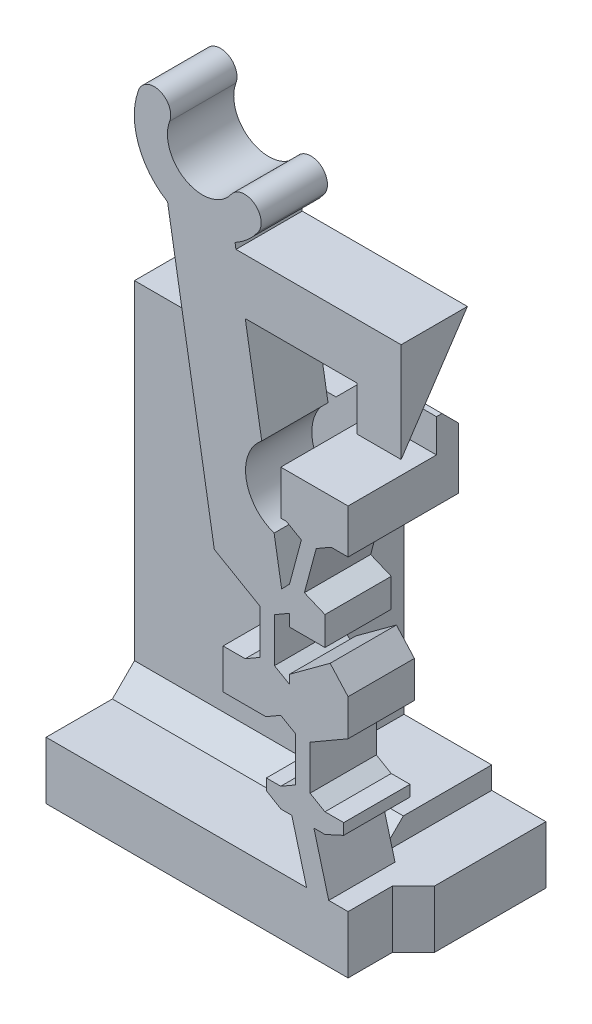
from build123d import *

# Parameters (mm, degrees)
BOSS_SWITCH_BODY_DEPTH                    = 3
SKETCH1_W                                 = 4
SKETCH1_H                                 = 3.5
BOSS_FLANGE_WIDTH_DEPTH                   = 5
BOSS_FLANGE_HEIGHT_REACH                  = 35.863
SKETCH2_W                                 = 4
SKETCH2_H                                 = 2
SKETCH2_W_2                               = 8
SKETCH2_H_2                               = 2.602328973
CUT_UP_TO_DOWN_DERAILLEUR_CLEARANCE_REACH = 21.462
SKETCH10_W                                = 2.453096586
SKETCH10_H                                = 3
SKETCH17_W                                = 12.1675
SKETCH17_H                                = 4
BOSS_FLANGE_SUPPORT_DEPTH                 = 13.897671027
TAP_DRILL_FOR_M2X0_4_TAP1_D               = 1.6
M2_CLEARANCE_HOLE2_D                      = 2.4
M2_CLEARANCE_HOLE2_DEPTH                  = 15
M2_CLEARANCE_HOLE2_TIP                    = 0.721032743
CHAMFER_FLANGE_SUPPORT_SIZE               = 1.5
CHAMFER_FLANGE_SUPPORT_2_SIZE             = 1.5
CHAMFER_FLANGE_SUPPORT_3_SIZE             = 1
SKETCH23_W                                = 3.9675
SKETCH23_H                                = 11.397671027
CUT_GAP_FOR_PRINTING_DEPTH                = 32.000499688
SKETCH25_W                                = 0.953096586
SKETCH25_H                                = 3.5
CUT_DERAILLEUR_CLEARANCE_DEPTH            = 32.145320369
CHAMFER8_SIZE                             = 1
CUT_UP_TO_DOWN_CANTILEVER_SLOPE_REACH     = 31.869
SKETCH26_W                                = 12.477246204
SKETCH26_H                                = 5.771077126
CUT_WIDE_DERAILLEUR_CLEARANCE_DEPTH       = 33.195879702
CUT_WIDE_DERAILLEUR_CLEARANCE_DEPTH_BACK  = 4
SKETCH27_W                                = 2.5
SKETCH27_H                                = 5.000000046
CHAMFER9_SIZE                             = 1.25
SKETCH28_W                                = 3.046903414
SKETCH28_H                                = 1.5
CUT_EXTRUDE1_DEPTH                        = 1


# Some blends are built 0.0001 mm under size
with BuildPart() as part:
    # Sketch-SwitchBossUp → Boss-Switch Body (new body)
    with BuildSketch(Plane.XY):
        with BuildLine():
            Line((5.581091201, 12.55524379), (5.581100766, 11.263016279))
            Line((5.581100766, 11.263016279), (3.971265023, 11.263016279))
            Line((3.971265023, 11.263016279), (3.97126394, 11.79911022))
            Line((3.97126394, 11.79911022), (3.296271341, 11.409403061))
            Line((3.296271341, 11.409403061), (3.296271341, 9.409403061))
            Line((3.296271341, 9.409403061), (3.971278743, 9.019687356))
            Line((3.971278743, 9.019687356), (3.971278743, 9.409408058))
            Line((3.971278743, 9.409408058), (5.815189336, 10.763016279))
            Line((5.815189336, 10.763016279), (6.627976927, 9.860324207))
            Line((6.627976927, 9.860324207), (6.627976927, 8.210536505))
            Line((6.627976927, 8.210536505), (5.581127833, 7.606137899))
            Line((5.581127833, 7.606137899), (4.906138119, 7.216432406))
            Line((4.906138119, 7.216432406), (4.906138119, 5.216432406))
            Line((4.906138119, 5.216432406), (5.58114552, 4.826716701))
            Line((5.58114552, 4.826716701), (6.430577026, 4.826716701))
            Line((6.430577026, 4.826716701), (6.430577026, 4.326716701))
            Line((6.430577026, 4.326716701), (5.582379266, 3.937018274))
            Line((5.582379266, 3.937018274), (5.081138119, 3.937018274))
            Line((5.081138119, 3.937018274), (5.7510111, 1.437018274))
            Line((5.7510111, 1.437018274), (6.627976927, 1.437018274))
            Line((6.627976927, 1.437018274), (6.627976927, -1.165310699))
            Line((6.627976927, -1.165310699), (3.034464198, -1.165310699))
            Line((3.034464198, -1.165310699), (3.034464198, 1.437018274))
            Line((3.034464198, 1.437018274), (4.7510111, 1.437018274))
            Line((4.7510111, 1.437018274), (4.081138119, 3.937018274))
            Line((4.081138119, 3.937018274), (3.585032728, 3.937018274))
            Line((3.585032728, 3.937018274), (2.930577026, 4.326720436))
            Line((2.930577026, 4.326720436), (2.930577026, 4.826720436))
            Line((2.930577026, 4.826720436), (3.58114552, 4.826720436))
            Line((3.58114552, 4.826720436), (4.256138119, 5.216427595))
            Line((4.256138119, 5.216427595), (4.256138119, 7.216427595))
            Line((4.256138119, 7.216427595), (3.581130717, 7.6061433))
            Line((3.581130717, 7.6061433), (2.9061262, 7.216422599))
            Line((2.9061262, 7.216422599), (0.971281627, 7.216422599))
            Line((0.971281627, 7.216422599), (0.971281627, 9.019692757))
            Line((0.971281627, 9.019692757), (1.971281627, 9.019692757))
            Line((1.971281627, 9.019692757), (2.646271341, 9.40939825))
            Line((2.646271341, 9.40939825), (2.646271341, 11.40939825))
            Line((2.646271341, 11.40939825), (1.696557212, 11.957715958))
            Line((1.696557212, 11.957715958), (0.573317845, 12.60621851))
            Line((0.573317845, 12.60621851), (-1.541303694, 25.167805745))
            ThreePointArc((-1.541303694, 25.167805745), (-2.872284003, 26.795385437), (-2.852546321, 28.897797067))
            ThreePointArc((-2.852546321, 28.897797067), (-1.887813913, 29.338582026), (-1.447028953, 28.373849618))
            ThreePointArc((-1.447028953, 28.373849618), (-0.703448682, 26.416936722), (1.333779254, 26.898727173))
            ThreePointArc((1.333779254, 26.898727173), (2.379722745, 27.074801628), (2.555797201, 26.028858137))
            ThreePointArc((2.555797201, 26.028858137), (2.086504637, 25.507104397), (1.511513111, 25.104801997))
            Line((1.511513111, 25.104801997), (1.553598189, 24.854801997))
            Line((1.553598189, 24.854801997), (9.027976927, 24.854801997))
            Line((9.027976927, 24.854801997), (9.027976927, 22.354801997))
            Line((9.027976927, 22.354801997), (9.027976927, 20.354801997))
            Line((9.027976927, 20.354801997), (7.027976927, 20.354801997))
            Line((7.027976927, 20.354801997), (7.027976927, 22.354801997))
            Line((7.027976927, 22.354801997), (1.974448974, 22.354801997))
            Line((1.974448974, 22.354801997), (2.719778232, 17.927287042))
            ThreePointArc((2.719778232, 17.927287042), (2.013826204, 16.096957693), (3.280124137, 14.598637521))
            Line((3.280124137, 14.598637521), (3.620297651, 12.577888564))
            Line((3.620297651, 12.577888564), (3.976674365, 12.944956135))
            Line((3.976674365, 12.944956135), (4.512557947, 14.944960101))
            Line((4.512557947, 14.944960101), (3.837515632, 15.334689301))
            Line((3.837515632, 15.334689301), (3.581073513, 15.334689301))
            Line((3.581073513, 15.334689301), (3.581073513, 17.334689301))
            Line((3.581073513, 17.334689301), (5.725580434, 17.334689301))
            Line((5.725580434, 17.334689301), (6.627976927, 17.334689301))
            Line((6.627976927, 17.334689301), (6.627976927, 15.334689301))
            Line((6.627976927, 15.334689301), (5.860498075, 15.334689301))
            Line((5.860498075, 15.334689301), (5.185487464, 14.944965082))
            Line((5.185487464, 14.944965082), (4.649603883, 12.944961115))
            Line((4.649603883, 12.944961115), (5.581091201, 12.55524379))
        make_face()
    extrude(amount=BOSS_SWITCH_BODY_DEPTH)

    # Sketch1 → Boss-Flange Width (add)
    with BuildSketch(Plane(origin=(0, 0, 0), x_dir=(-1, 0, 0), z_dir=(0, 0, -1))):
        Polygon((-7.581073513, -1.165310699), (0.412170615, -1.165310699), (0.412170615, 1.437018274), (-3.034464198, 1.437018274), (-4.7510111, 1.437018274), (-5.7510111, 1.437018274), (-6.627976927, 1.437018274), (-7.581073513, 1.437018274), align=None)
        with Locations((-5.581073513, 17.084689301)):
            Rectangle(SKETCH1_W, SKETCH1_H)
    extrude(amount=BOSS_FLANGE_WIDTH_DEPTH)

    # Sketch2 → Boss-Flange Height (add, up to next)
    with BuildSketch(Plane(origin=(-7.039523073, 0, 0), x_dir=(0, 0, -1), z_dir=(1, 0, 0)), mode=Mode.PRIVATE) as boss_flange_height_sk1:
        with Locations((3, 16.334689301)):
            Rectangle(SKETCH2_W, SKETCH2_H)
    boss_flange_height_tool1 = extrude(boss_flange_height_sk1.sketch, amount=BOSS_FLANGE_HEIGHT_REACH, mode=Mode.PRIVATE) - part.part
    # Sketch2 → Boss-Flange Height (add, up to next)
    with BuildSketch(Plane(origin=(-7.039523073, 0, 0), x_dir=(0, 0, -1), z_dir=(1, 0, 0)), mode=Mode.PRIVATE) as boss_flange_height_sk2:
        with Locations((1, 0.135853787)):
            Rectangle(SKETCH2_W_2, SKETCH2_H_2)
    boss_flange_height_tool2 = extrude(boss_flange_height_sk2.sketch, amount=BOSS_FLANGE_HEIGHT_REACH, mode=Mode.PRIVATE) - part.part
    add(boss_flange_height_tool1.solids().sort_by_distance((-7.039523, 16.334689, -3))[0])
    add(boss_flange_height_tool2.solids().sort_by_distance((-7.039523, 0.135854, -1))[0])

    # Sketch10 → Cut-Up-To-Down Derailleur Clearance (cut, up to next)
    with BuildSketch(Plane(origin=(0, 15.334689301, 0), x_dir=(1, 0, 0), z_dir=(0, 1, 0)), mode=Mode.PRIVATE) as cut_up_to_down_derailleur_clearance_sk1:
        with Locations((6.35452522, 3.5)):
            Rectangle(SKETCH10_W, SKETCH10_H)
    cut_up_to_down_derailleur_clearance_tool1 = extrude(cut_up_to_down_derailleur_clearance_sk1.sketch, amount=CUT_UP_TO_DOWN_DERAILLEUR_CLEARANCE_REACH, mode=Mode.PRIVATE) & part.part
    add(cut_up_to_down_derailleur_clearance_tool1.solids().sort_by_distance((6.354525, 15.334689, -3.5))[0], mode=Mode.SUBTRACT)

    # Sketch17 → Boss-Flange Support (add)
    with BuildSketch(Plane.XZ.offset(-15.334689301)):
        with Locations((-0.955773073, -3)):
            Rectangle(SKETCH17_W, SKETCH17_H)
    extrude(amount=BOSS_FLANGE_SUPPORT_DEPTH)

    # Tap Drill for M2x0.4 Tap1 (through all)
    with Locations(Plane(origin=(0, -1.165310699, 0), x_dir=(-1, 0, 0), z_dir=(0, -1, 0))):
        with Locations((5.039523073, 3), (0.539523073, 3)):
            Hole(TAP_DRILL_FOR_M2X0_4_TAP1_D / 2)

    # M2 Clearance Hole2
    with Locations(Plane.XZ.offset(1.165310699)):
        with Locations((-5.039523073, -3), (-0.539523073, -3)):
            Hole(M2_CLEARANCE_HOLE2_D / 2, depth=M2_CLEARANCE_HOLE2_DEPTH)
            with Locations((0, 0, -(M2_CLEARANCE_HOLE2_DEPTH + M2_CLEARANCE_HOLE2_TIP / 2))):  # 118° drill point
                Cone(0, M2_CLEARANCE_HOLE2_D / 2, M2_CLEARANCE_HOLE2_TIP, mode=Mode.SUBTRACT)

    # Chamfer-Flange Support
    chamfer_flange_support_edges = [part.edges().sort_by_distance(p)[0] for p in [
        (3.581073513, 17.334689301, -3),
    ]]
    chamfer(chamfer_flange_support_edges, length=CHAMFER_FLANGE_SUPPORT_SIZE - 0.0001)  # a hair under: the kernel refuses the full size

    # Chamfer-Flange Support 2
    chamfer_flange_support_2_edges = [part.edges().sort_by_distance(p)[0] for p in [
        (5.127976927, 17.084689301, -2),
        (5.127976927, 15.334689301, -1.5),
    ]]
    chamfer(chamfer_flange_support_2_edges, length=CHAMFER_FLANGE_SUPPORT_2_SIZE)

    # Chamfer-Flange Support 3
    chamfer_flange_support_3_edges = [part.edges().sort_by_distance(p)[0] for p in [
        (-0.955773073, 1.437018274, -1),
    ]]
    chamfer(chamfer_flange_support_3_edges, length=CHAMFER_FLANGE_SUPPORT_3_SIZE - 0.0001)  # a hair under: the kernel refuses the full size

    # Sketch23 → Cut-Gap for Printing (cut, through all)
    with BuildSketch(Plane.XY.offset(-1)):
        with Locations((3.144226927, 8.135853788)):
            Rectangle(SKETCH23_W, SKETCH23_H)
    extrude(amount=-CUT_GAP_FOR_PRINTING_DEPTH, mode=Mode.SUBTRACT)

    # Sketch25 → Cut-Derailleur Clearance (cut, through all)
    with BuildSketch(Plane.XY):
        with Locations((7.10452522, 17.084689301)):
            Rectangle(SKETCH25_W, SKETCH25_H)
    extrude(amount=-CUT_DERAILLEUR_CLEARANCE_DEPTH, mode=Mode.SUBTRACT)

    # Chamfer8
    # the kernel refuses this chamfer: 1 mm, written as the material it adds along each edge
    with BuildSketch(Plane(origin=(6.627976927, 1.437018274, 0), x_dir=(0.9996219169112968, 0, -0.027495876610586365), z_dir=(0, -1, 0))) as chamfer8_piece_1_section:
        Polygon((CHAMFER8_SIZE * 0.999621916911, CHAMFER8_SIZE * 0.0274958766106), (-CHAMFER8_SIZE * 0.0274958766106, CHAMFER8_SIZE * 0.999621916911), (0, 0), align=None)
    chamfer8_piece_1 = extrude(amount=2.602328973, mode=Mode.PRIVATE)
    chamfer8_piece_1 = split(chamfer8_piece_1, bisect_by=Plane(origin=(7.581073513, 0.135853788, 0.332375145), z_dir=(-1, 0, 0)), keep=Keep.TOP, mode=Mode.PRIVATE)
    add(chamfer8_piece_1)

    # Sketch26 → Cut-Up-to-Down Cantilever Slope (cut, up to next)
    with BuildSketch(Plane(origin=(-3.086642121, 5.589000146, 8.383500218), x_dir=(-0.9561404375276108, -0.1624764728289173, -0.24371470924337582), z_dir=(0.2929086269205964, -0.5303712883154423, -0.795556932473163)), mode=Mode.PRIVATE) as cut_up_to_down_cantilever_slope_sk1:
        with Locations((-13.791615152, 17.794906754)):
            Rectangle(SKETCH26_W, SKETCH26_H)
    cut_up_to_down_cantilever_slope_tool1 = extrude(cut_up_to_down_cantilever_slope_sk1.sketch, amount=CUT_UP_TO_DOWN_CANTILEVER_SLOPE_REACH, mode=Mode.PRIVATE) & part.part
    add(cut_up_to_down_cantilever_slope_tool1.solids().sort_by_distance((10.100079, 22.636071, 1.873881))[0], mode=Mode.SUBTRACT)

    # Sketch27 → Cut-Wide Derailleur Clearance (cut, two sides: drawn at the far end of the back side and taken through both)
    with BuildSketch(Plane(origin=(5.127976927, 0, 0), x_dir=(0, 0, -1), z_dir=(1, 0, 0)).offset(-CUT_WIDE_DERAILLEUR_CLEARANCE_DEPTH_BACK)):
        with Locations((3.75, 16.334689324)):
            Rectangle(SKETCH27_W, SKETCH27_H)
    extrude(amount=CUT_WIDE_DERAILLEUR_CLEARANCE_DEPTH + CUT_WIDE_DERAILLEUR_CLEARANCE_DEPTH_BACK, mode=Mode.SUBTRACT)

    # Chamfer9
    chamfer9_edges = [part.edges().sort_by_distance(p)[0] for p in [
        (4.85452522, 18.834689347, -2.5),
    ]]
    chamfer(chamfer9_edges, length=CHAMFER9_SIZE)

    # Sketch28 → Cut-Extrude1 (cut)
    with BuildSketch(Plane.XY.offset(-1)):
        with Locations((5.10452522, 18.084689301)):
            Rectangle(SKETCH28_W, SKETCH28_H)
    extrude(amount=CUT_EXTRUDE1_DEPTH, mode=Mode.SUBTRACT)


solid = part.part
